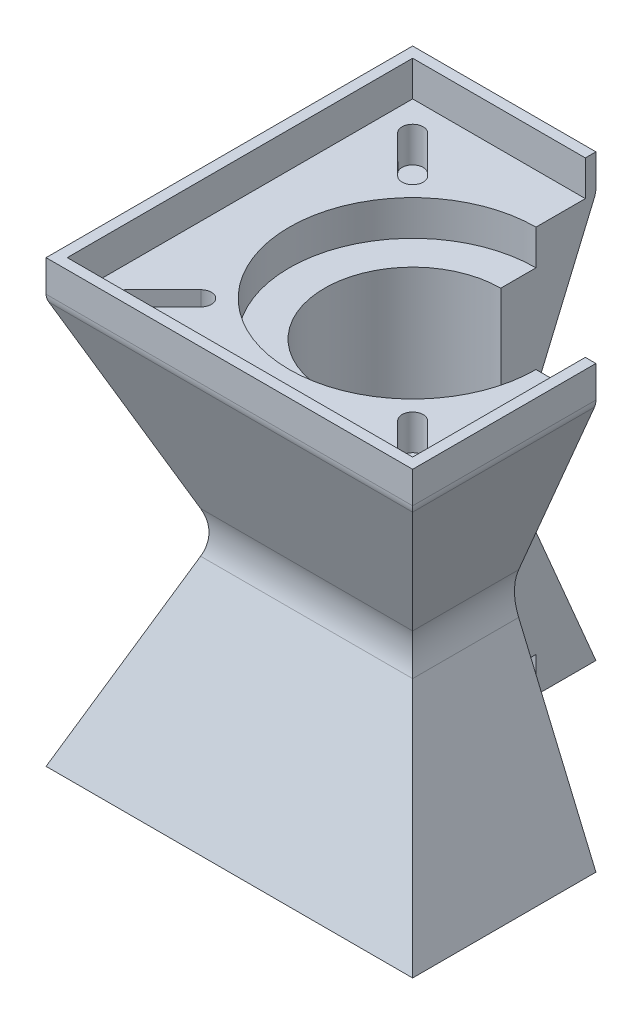
from build123d import *

# Parameters (mm, degrees)
SKETCH1_W           = 104
SKETCH1_H           = 104
BOSS_EXTRUDE1_DEPTH = 57.5
BOSS_EXTRUDE1_DRAFT = -23
SKETCH1_3_R         = 25
CUT_EXTRUDE1_DEPTH  = 94.350147295
SKETCH3_R           = 35
CUT_EXTRUDE2_DEPTH  = 10
SKETCH4_W           = 95.556530254
SKETCH4_H           = 88.466852203
CUT_EXTRUDE3_DEPTH  = 137.502747225
FILLET1_R           = 15
BOSS_EXTRUDE2_DEPTH = 10
FILLET2_R           = 5
CUT_EXTRUDE4_DEPTH  = 10


# Read off the part's stored shape, not the designer's step: Mirror2
with BuildPart() as part:
    # Sketch1 → Boss-Extrude1 (with draft: the straight prism first)
    with BuildSketch(Plane(origin=(0, 0, 0), x_dir=(1, 0, 0), z_dir=(0, 1, 0))):
        Rectangle(SKETCH1_W, SKETCH1_H)
    extrude(amount=-BOSS_EXTRUDE1_DEPTH)
    # Boss-Extrude1: the draft: its side faces are tilted about the plane it starts from
    boss_extrude1_sides = [part.faces().sort_by_distance(p)[0] for p in [
        (-52, -28.75, 0),
        (0, -28.75, 52),
        (52, -28.75, 0),
        (0, -28.75, -52),
    ]]
    draft(boss_extrude1_sides, Plane(origin=(0, 0, 0), x_dir=(1, 0, 0), z_dir=(0, 1, 0)), BOSS_EXTRUDE1_DRAFT)

    # Sketch1<3> → Cut-Extrude1 (cut, through all)
    with BuildSketch(Plane(origin=(0, 0, 0), x_dir=(1, 0, 0), z_dir=(0, 1, 0))):
        with Locations(Location((0, 0, 0), (0, 0, 270))):
            Circle(SKETCH1_3_R)
    extrude(amount=-CUT_EXTRUDE1_DEPTH, mode=Mode.SUBTRACT)

    # Sketch3 → Cut-Extrude2 (cut)
    with BuildSketch(Plane(origin=(0, 0, 0), x_dir=(1, 0, 0), z_dir=(0, 1, 0))):
        with Locations(Location((0, 0, 0), (0, 0, 270))):
            Circle(SKETCH3_R)
    extrude(amount=-CUT_EXTRUDE2_DEPTH, mode=Mode.SUBTRACT)

    # Mirror2: part across plane


with BuildPart() as part_1:
    add(part.part)
    add(part.part.mirror(Plane.ZX.offset(-57.5)))

    # Sketch4 → Cut-Extrude3 (cut, through all)
    with BuildSketch(Plane(origin=(0, 0, 0), x_dir=(1, 0, 0), z_dir=(0, 1, 0))):
        with Locations((47.778265127, 44.233426102)):
            Rectangle(SKETCH4_W, SKETCH4_H)
    extrude(amount=-CUT_EXTRUDE3_DEPTH, mode=Mode.SUBTRACT)

    # Fillet1
    fillet1_edges = [part_1.edges().sort_by_distance(p)[0] for p in [
        (-13.796349034, -57.5, -27.592698068),
        (-27.592698068, -57.5, 0),
        (0, -57.5, 27.592698068),
        (27.592698068, -57.5, 13.796349034),
    ]]
    fillet(fillet1_edges, radius=FILLET1_R)

    # Sketch5 → Boss-Extrude2 (add)
    with BuildSketch(Plane(origin=(0, 0, 0), x_dir=(1, 0, 0), z_dir=(0, 1, 0))):
        Polygon((-49, 49), (-49, -49), (49, -49), (49, -3), (49, 0), (52, 0), (52, -52), (-52, -52), (-52, 52), (0, 52), (0, 49), (-3, 49), align=None)
    extrude(amount=BOSS_EXTRUDE2_DEPTH)

    # Fillet2
    fillet2_edges = [part_1.edges().sort_by_distance(p)[0] for p in [
        (-52, 0, 0),
        (-26, 0, -52),
        (52, 0, 26),
        (0, 0, 52),
    ]]
    fillet(fillet2_edges, radius=FILLET2_R)

    # Sketch6 → Cut-Extrude4 (cut)
    with BuildSketch(Plane(origin=(0, 0, 0), x_dir=(1, 0, 0), z_dir=(0, 1, 0))):
        with BuildLine():
            Line((-42.779960262, -38.537319575), (-32.173358544, -27.930717857))
            ThreePointArc((-32.173358544, -27.930717857), (-27.930717857, -27.930717857), (-27.930717857, -32.173358544))
            Line((-27.930717857, -32.173358544), (-38.537319575, -42.779960262))
            ThreePointArc((-38.537319575, -42.779960262), (-42.779960262, -42.779960262), (-42.779960262, -38.537319575))
        make_face()
        with BuildLine():
            Line((-38.537319575, 42.779960262), (-27.930717857, 32.173358544))
            ThreePointArc((-27.930717857, 32.173358544), (-27.930717857, 27.930717857), (-32.173358544, 27.930717857))
            Line((-32.173358544, 27.930717857), (-42.779960262, 38.537319575))
            ThreePointArc((-42.779960262, 38.537319575), (-42.779960262, 42.779960262), (-38.537319575, 42.779960262))
        make_face()
        with BuildLine():
            Line((38.537319575, -42.779960262), (27.930717857, -32.173358544))
            ThreePointArc((27.930717857, -32.173358544), (27.930717857, -27.930717857), (32.173358544, -27.930717857))
            Line((32.173358544, -27.930717857), (42.779960262, -38.537319575))
            ThreePointArc((42.779960262, -38.537319575), (42.779960262, -42.779960262), (38.537319575, -42.779960262))
        make_face()
    cut_extrude4 = extrude(amount=-CUT_EXTRUDE4_DEPTH, mode=Mode.SUBTRACT)

    # Mirror3: Cut-Extrude4 across plane
    add(cut_extrude4.mirror(Plane.ZX.offset(-57.5)), mode=Mode.SUBTRACT)


solid = part_1.part
